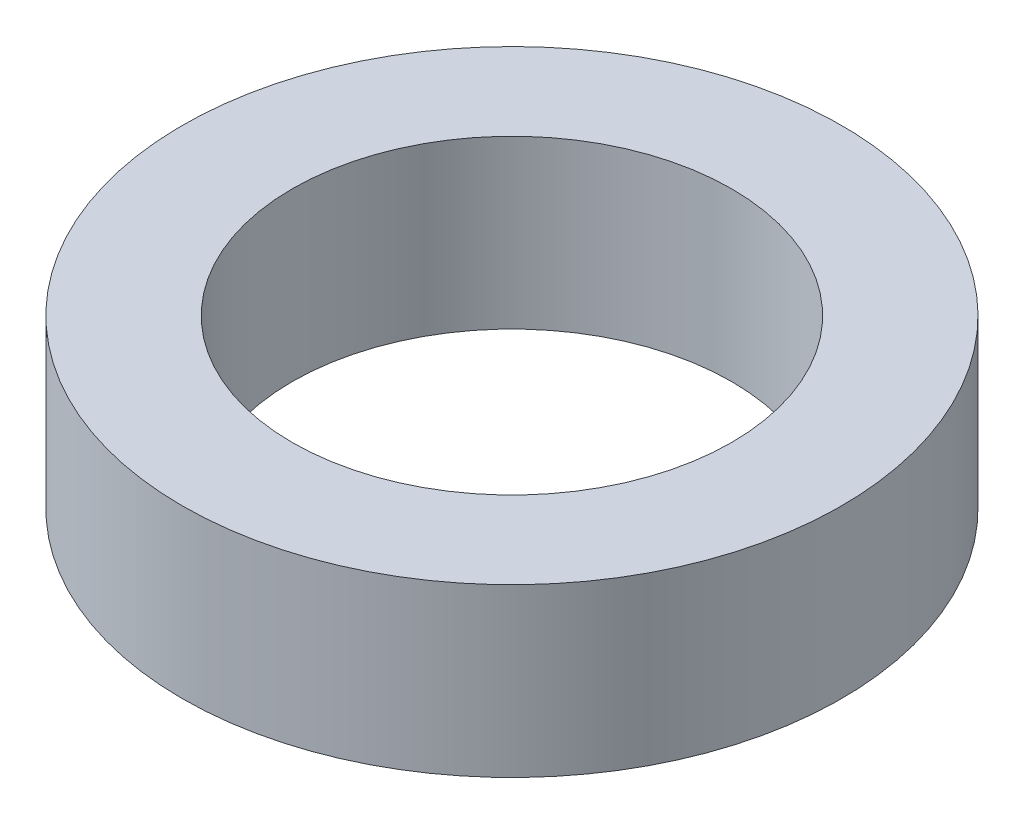
from build123d import *

# Parameters (mm, degrees)
SKETCH1_R           = 37.5
BOSS_EXTRUDE1_DEPTH = 19
SKETCH2_R           = 25
CUT_EXTRUDE1_DEPTH  = 57.333826428


with BuildPart() as part:
    # Sketch1 → Boss-Extrude1 (new body)
    with BuildSketch(Plane(origin=(0, 0, 0), x_dir=(1, 0, 0), z_dir=(0, 1, 0))):
        Circle(SKETCH1_R)
    extrude(amount=BOSS_EXTRUDE1_DEPTH)

    # Sketch2 → Cut-Extrude1 (cut, through all)
    with BuildSketch(Plane(origin=(0, 0, 0), x_dir=(1, 0, 0), z_dir=(0, 1, 0))):
        Circle(SKETCH2_R)
    extrude(amount=CUT_EXTRUDE1_DEPTH, mode=Mode.SUBTRACT)


solid = part.part
